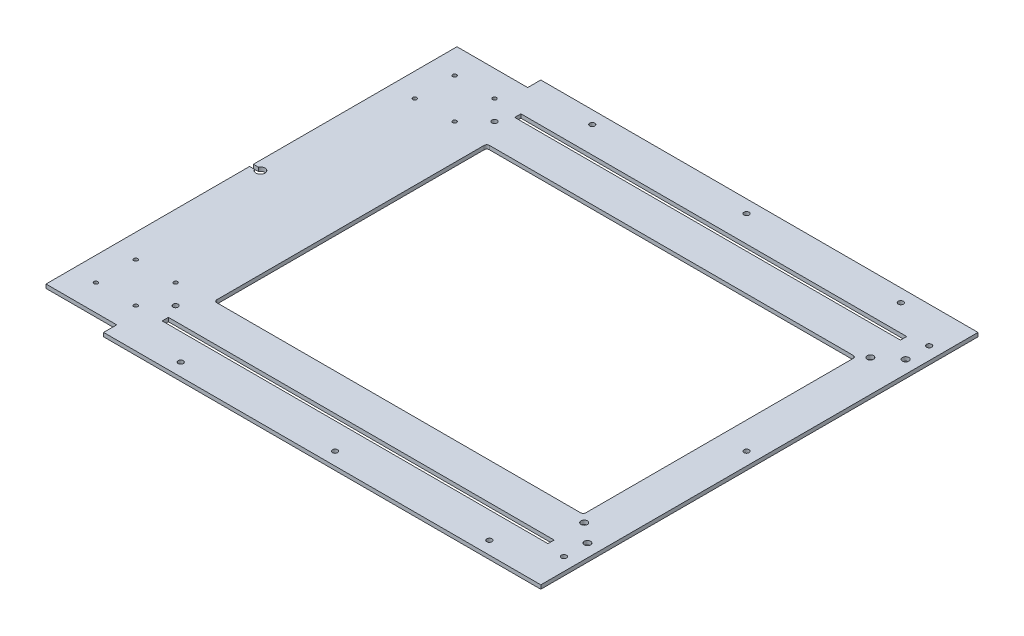
from build123d import *

# Parameters (mm, degrees)
SKETCH1_9_W         = 300
SKETCH1_9_H         = 4.85
SKETCH1_9_R         = 2
SKETCH1_9_R_2       = 2.5
SKETCH1_9_R_3       = 1.5
BOSS_EXTRUDE7_DEPTH = 3


with BuildPart() as part:
    # Sketch1<9> → Boss-Extrude7 (new body)
    with BuildSketch(Plane(origin=(0, 0, 0), x_dir=(1, 0, 0), z_dir=(0, 1, 0))):
        with BuildLine():
            Line((170, 170), (-170, 170))
            Line((-170, 170), (-170, 159.8))
            Line((-170, 159.8), (-225, 159.8))
            Line((-225, 159.8), (-225, 1.5))
            Line((-225, 1.5), (-221.16227766, 1.5))
            ThreePointArc((-221.16227766, 1.5), (-214.5, 0), (-221.16227766, -1.5))
            Line((-221.16227766, -1.5), (-225, -1.5))
            Line((-225, -1.5), (-225, -159.8))
            Line((-225, -159.8), (-170, -159.8))
            Line((-170, -159.8), (-170, -170))
            Line((-170, -170), (170, -170))
            Line((170, -170), (170, 170))
        make_face()
        with BuildLine():
            Line((145.054532446, -139.5), (139, -139.5))
            Line((139, -139.5), (139, -139.183771916))
            ThreePointArc((139, -139.183771916), (138.83126608, -139.34397613), (138.658659364, -139.5))
            Line((138.658659364, -139.5), (-154.945467554, -139.5))
            Line((-154.945467554, -139.5), (-154.945467554, -134.65))
            Line((-154.945467554, -134.65), (145.054532446, -134.65))
            Line((145.054532446, -134.65), (145.054532446, -139.5))
        make_face(mode=Mode.SUBTRACT)
        with BuildLine():
            Line((139, 104), (139, -104))
            ThreePointArc((139, -104), (138.414213562, -105.414213562), (137, -106))
            Line((137, -106), (-146, -106))
            ThreePointArc((-146, -106), (-147.414213562, -105.414213562), (-148, -104))
            Line((-148, -104), (-148, 104))
            ThreePointArc((-148, 104), (-147.414213562, 105.414213562), (-146, 106))
            Line((-146, 106), (137, 106))
            ThreePointArc((137, 106), (138.414213562, 105.414213562), (139, 104))
        make_face(mode=Mode.SUBTRACT)
        with Locations((-4.945467554, 137.075)):
            Rectangle(SKETCH1_9_W, SKETCH1_9_H, mode=Mode.SUBTRACT)
        with Locations((160, -142)):
            Circle(SKETCH1_9_R, mode=Mode.SUBTRACT)
        with Locations((160, -123.75)):
            Circle(SKETCH1_9_R_2, mode=Mode.SUBTRACT)
        with Locations((145, -111.25)):
            Circle(SKETCH1_9_R_2, mode=Mode.SUBTRACT)
        with Locations((160, 0)):
            Circle(SKETCH1_9_R, mode=Mode.SUBTRACT)
        with Locations((145, 111.25)):
            Circle(SKETCH1_9_R_2, mode=Mode.SUBTRACT)
        with Locations((160, 123.75)):
            Circle(SKETCH1_9_R_2, mode=Mode.SUBTRACT)
        with Locations((160, 142)):
            Circle(SKETCH1_9_R, mode=Mode.SUBTRACT)
        with Locations((-160, -124)):
            Circle(SKETCH1_9_R, mode=Mode.SUBTRACT)
        with Locations((-160, 124)):
            Circle(SKETCH1_9_R, mode=Mode.SUBTRACT)
        with Locations((0, -160)):
            Circle(SKETCH1_9_R, mode=Mode.SUBTRACT)
        with Locations((120, -160)):
            Circle(SKETCH1_9_R, mode=Mode.SUBTRACT)
        with Locations((-120, -160)):
            Circle(SKETCH1_9_R, mode=Mode.SUBTRACT)
        with Locations((120, 160)):
            Circle(SKETCH1_9_R, mode=Mode.SUBTRACT)
        with Locations((0, 160)):
            Circle(SKETCH1_9_R, mode=Mode.SUBTRACT)
        with Locations((-120, 160)):
            Circle(SKETCH1_9_R, mode=Mode.SUBTRACT)
        with Locations((-206.5, -108.5)):
            Circle(SKETCH1_9_R_3, mode=Mode.SUBTRACT)
        with Locations((-175.5, -108.5)):
            Circle(SKETCH1_9_R_3, mode=Mode.SUBTRACT)
        with Locations((-206.5, -139.5)):
            Circle(SKETCH1_9_R_3, mode=Mode.SUBTRACT)
        with Locations((-175.5, -139.5)):
            Circle(SKETCH1_9_R_3, mode=Mode.SUBTRACT)
        with Locations((-175.5, 139.5)):
            Circle(SKETCH1_9_R_3, mode=Mode.SUBTRACT)
        with Locations((-206.5, 139.5)):
            Circle(SKETCH1_9_R_3, mode=Mode.SUBTRACT)
        with Locations((-206.5, 108.5)):
            Circle(SKETCH1_9_R_3, mode=Mode.SUBTRACT)
        with Locations((-175.5, 108.5)):
            Circle(SKETCH1_9_R_3, mode=Mode.SUBTRACT)
    extrude(amount=BOSS_EXTRUDE7_DEPTH)


solid = part.part
